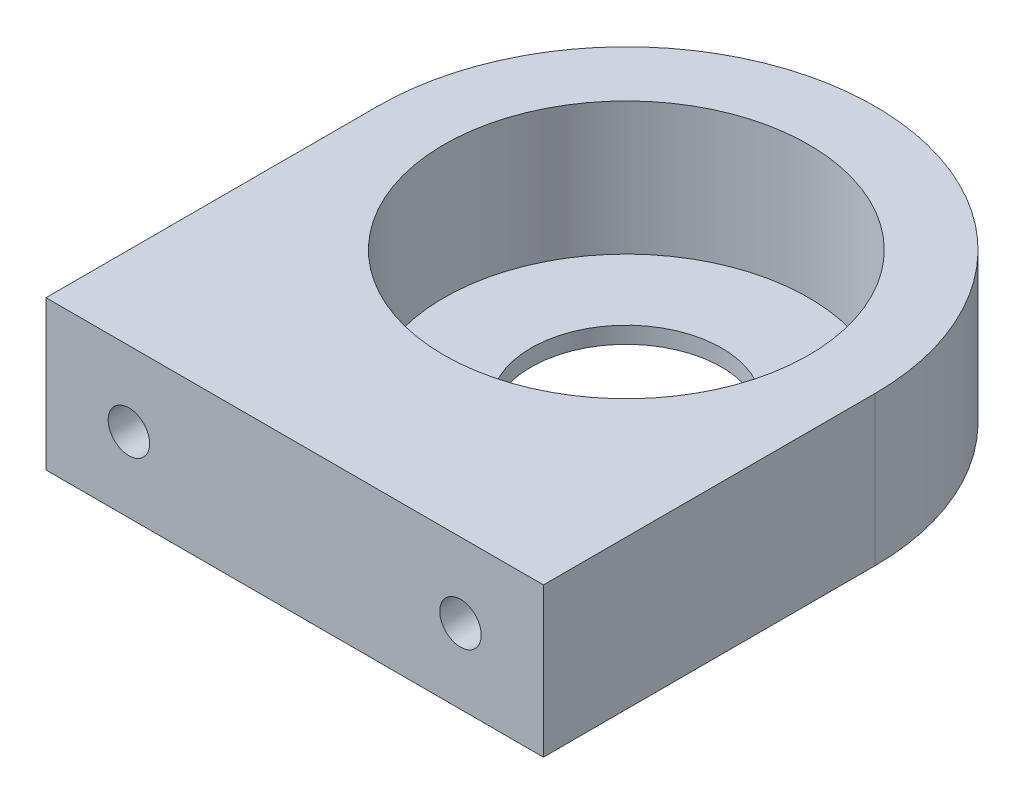
from build123d import *

# Parameters (mm, degrees)
SKETCH1_R           = 5.75
BOSS_EXTRUDE1_DEPTH = 9
SKETCH2_R           = 11
CUT_EXTRUDE1_DEPTH  = 8
SKETCH8_R           = 1.25
CUT_EXTRUDE2_DEPTH  = 10


with BuildPart() as part:
    # Sketch1 → Boss-Extrude1 (new body)
    with BuildSketch(Plane(origin=(0, 0, 0), x_dir=(1, 0, 0), z_dir=(0, 1, 0))):
        with BuildLine():
            Line((0, 0), (30, 0))
            Line((30, 0), (30, 20))
            ThreePointArc((30, 20), (15, 35), (0, 20))
            Line((0, 20), (0, 0))
        make_face()
        with Locations((15, 20)):
            Circle(SKETCH1_R, mode=Mode.SUBTRACT)
    extrude(amount=BOSS_EXTRUDE1_DEPTH)

    # Sketch2 → Cut-Extrude1 (cut)
    with BuildSketch(Plane(origin=(0, 9, 0), x_dir=(1, 0, 0), z_dir=(0, 1, 0))):
        with Locations((15, 20)):
            Circle(SKETCH2_R)
    extrude(amount=-CUT_EXTRUDE1_DEPTH, mode=Mode.SUBTRACT)

    # Sketch8 → Cut-Extrude2 (cut)
    with BuildSketch(Plane.XY):
        with Locations((25, 4.5)):
            Circle(SKETCH8_R)
        with Locations((5, 4.5)):
            Circle(SKETCH8_R)
    extrude(amount=-CUT_EXTRUDE2_DEPTH, mode=Mode.SUBTRACT)


solid = part.part
